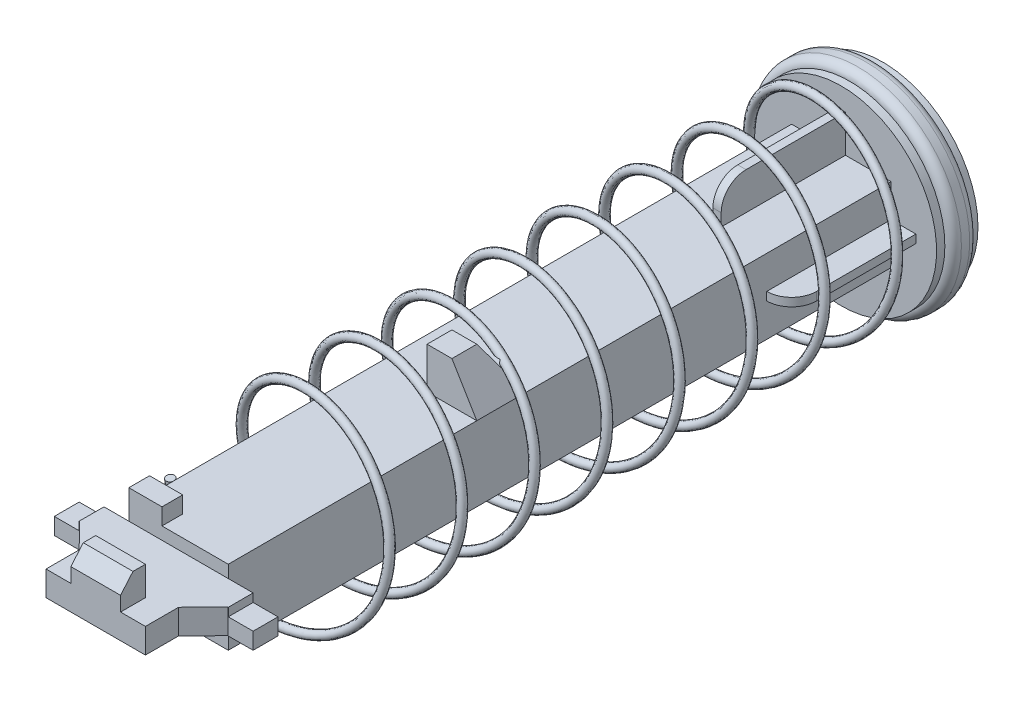
from build123d import *

# Parameters (mm, degrees)
SKETCH2_R            = 11.5
BOSS_EXTRUDE1_DEPTH  = 1
SKETCH3_R            = 12.5
BOSS_EXTRUDE2_DEPTH  = 3
FILLET1_R            = 1
SKETCH4_R            = 11.5
BOSS_EXTRUDE3_DEPTH  = 1
SKETCH5_W            = 12
SKETCH5_H            = 9
BOSS_EXTRUDE4_DEPTH  = 80
SKETCH6_W            = 1
SKETCH6_H            = 4.5
SKETCH6_W_2          = 3
SKETCH6_H_2          = 1
BOSS_EXTRUDE5_DEPTH  = 15
FILLET2_R            = 3
SWEEP1_PITCH         = 8.75
SKETCH28_R           = 7.5
CUT_EXTRUDE3_DEPTH   = 3
FILLET3_R            = 0.5
BOSS_EXTRUDE6_DEPTH  = 6
SKETCH34_W           = 12
SKETCH34_H           = 2
SKETCH34_H_2         = 1
BOSS_EXTRUDE7_DEPTH  = 4
SKETCH35_W           = 6
SKETCH35_H           = 3
BOSS_EXTRUDE8_DEPTH  = 2
SKETCH44_W           = 6
SKETCH44_H           = 3
BOSS_EXTRUDE12_DEPTH = 3
SKETCH37_W           = 4
SKETCH37_H           = 2.5
BOSS_EXTRUDE9_DEPTH  = 2
CUT_EXTRUDE5_DEPTH   = 97.630740463
SKETCH39_W           = 6
SKETCH39_H           = 6
BOSS_EXTRUDE10_DEPTH = 5
CUT_EXTRUDE6_REACH   = 59.771
CUT_EXTRUDE7_REACH   = 98.631
CUT_EXTRUDE8_REACH   = 99.064


with BuildPart() as part:
    # Sketch2 → Boss-Extrude1 (new body)
    with BuildSketch(Plane.XY):
        Circle(SKETCH2_R)
    extrude(amount=BOSS_EXTRUDE1_DEPTH)

    # Sketch3 → Boss-Extrude2 (add)
    with BuildSketch(Plane.XY.offset(1)):
        Circle(SKETCH3_R)
    extrude(amount=BOSS_EXTRUDE2_DEPTH)

    # Fillet1
    fillet1_edges = [part.edges().sort_by_distance(p)[0] for p in [
        (-12.5, 0, 1),
        (-12.5, 0, 4),
    ]]
    fillet(fillet1_edges, radius=FILLET1_R - 0.0001)  # a hair under: the kernel refuses the full size

    # Sketch4 → Boss-Extrude3 (add)
    with BuildSketch(Plane.XY.offset(4)):
        Circle(SKETCH4_R)
    extrude(amount=BOSS_EXTRUDE3_DEPTH)

    # Sketch5 → Boss-Extrude4 (add)
    with BuildSketch(Plane.XY.offset(5)):
        Rectangle(SKETCH5_W, SKETCH5_H)
    extrude(amount=BOSS_EXTRUDE4_DEPTH)

    # Sketch6 → Boss-Extrude5 (add)
    with BuildSketch(Plane.XY.offset(5)):
        with Locations((0, 6.75)):
            Rectangle(SKETCH6_W, SKETCH6_H)
        with Locations((7.5, 0.017199554)):
            Rectangle(SKETCH6_W_2, SKETCH6_H_2)
        with Locations((0, -6.75)):
            Rectangle(SKETCH6_W, SKETCH6_H)
        with Locations((-7.5, 0.017199554)):
            Rectangle(SKETCH6_W_2, SKETCH6_H_2)
    extrude(amount=BOSS_EXTRUDE5_DEPTH)

    # Fillet2
    fillet2_edges = [part.edges().sort_by_distance(p)[0] for p in [
        (9, 0.017199554, 20),
        (0, -9, 20),
        (0, 9, 20),
        (-9, 0.017199554, 20),
    ]]
    fillet(fillet2_edges, radius=FILLET2_R - 0.0001)  # a hair under: the kernel refuses the full size

    # Sweep1: arcs per turn and ends read off the stored shape
    # Sweep1: the profile of Sweep1 profile screwed along a left-hand helix through 8 turns, 16 arcs to a turn; built about Z, then put on its axis
    sweep1_z = Axis((0, 0, 0), (0, 0, 1))
    sweep1_corners = [(11, 0.062799, 0.496040609), (10.5, 0, 0), (11, -0.062799, -0.496040609), (11.5, 0, 0)]
    with BuildLine(mode=Mode.PRIVATE) as sweep1_profile:
        ThreePointArc((11, 0.062799, 0.496040609), (10.646446609, 0.044405599, 0.350753678), (10.5, 0, 0))
        ThreePointArc((10.5, 0, 0), (10.646446609, -0.044405599, -0.350753678), (11, -0.062799, -0.496040609))
        ThreePointArc((11, -0.062799, -0.496040609), (11.353553391, -0.044405599, -0.350753678), (11.5, 0, 0))
        ThreePointArc((11.5, 0, 0), (11.353553391, 0.044405599, 0.350753678), (11, 0.062799, 0.496040609))
    sweep1_cap = Face(sweep1_profile.wire())
    sweep1_arcs = [((11, 0.062799, 0.496040609), (10.5, 0.062799, 0.496040609), (10.5, 0, 0), (1, 0.7071067811865476, 1)), ((10.5, 0, 0), (10.5, -0.062799, -0.496040609), (11, -0.062799, -0.496040609), (1, 0.7071067811865476, 1)), ((11, -0.062799, -0.496040609), (11.5, -0.062799, -0.496040609), (11.5, 0, 0), (1, 0.7071067811865476, 1)), ((11.5, 0, 0), (11.5, 0.062799, 0.496040609), (11, 0.062799, 0.496040609), (1, 0.7071067811865476, 1))]  # start, shoulder, end, weights
    sweep1_turn_angles = [0, -11.25, -22.5, -33.75, -45, -56.25, -67.5, -78.75, -90, -101.25, -112.5, -123.75, -135, -146.25, -157.5, -168.75, -180, -191.25, -202.5, -213.75, -225, -236.25, -247.5, -258.75, -270, -281.25, -292.5, -303.75, -315, -326.25, -337.5, -348.75, -360]
    sweep1_turn_weights = [1, 0.9807852804032304, 1, 0.9807852804032304, 1, 0.9807852804032304, 1, 0.9807852804032304, 1, 0.9807852804032304, 1, 0.9807852804032304, 1, 0.9807852804032304, 1, 0.9807852804032304, 1, 0.9807852804032304, 1, 0.9807852804032304, 1, 0.9807852804032304, 1, 0.9807852804032304, 1, 0.9807852804032304, 1, 0.9807852804032304, 1, 0.9807852804032304, 1, 0.9807852804032304, 1]
    sweep1_turn_sides = [Face.make_bezier_surface([[Vector(p[j][0], p[j][1], 0).rotate(sweep1_z, sweep1_turn_angles[2 * i + k]) / sweep1_turn_weights[2 * i + k] + Vector(0, 0, p[j][2] + -SWEEP1_PITCH * sweep1_turn_angles[2 * i + k] / 360) for k in range(3)] for j in range(3)], [[p[3][j] * sweep1_turn_weights[2 * i + k] for k in range(3)] for j in range(3)]) for p in sweep1_arcs for i in range(16)]
    sweep1 = Plane(origin=(0, 0, 5), x_dir=(-1, 0, 0), z_dir=(0, 0, 1)) * Solid(Shell([*[p.moved(Location((0, 0, SWEEP1_PITCH * i))) for i in range(8) for p in sweep1_turn_sides], sweep1_cap, sweep1_cap.rotate(sweep1_z, -2880).moved(Location((0, 0, -SWEEP1_PITCH * -2880 / 360)))]))
    add(sweep1)

    # Sketch28 → Cut-Extrude3 (cut)
    with BuildSketch(Plane(origin=(0, 0, 0), x_dir=(-1, 0, 0), z_dir=(0, 0, -1))):
        Circle(SKETCH28_R)
    extrude(amount=-CUT_EXTRUDE3_DEPTH, mode=Mode.SUBTRACT)

    # Fillet3
    fillet3_edges = [part.edges().sort_by_distance(p)[0] for p in [
        (7.5, 0, 0),
    ]]
    fillet(fillet3_edges, radius=FILLET3_R)

    # Sketch33 → Boss-Extrude6 (add)
    with BuildSketch(Plane.XY.offset(85)):
        Polygon((9, 3), (-9, 3), (-9, 2), (-12, 2), (-12, 0), (12, 0), (12, 2), (9, 2), align=None)
    extrude(amount=BOSS_EXTRUDE6_DEPTH)

    # Sketch34 → Boss-Extrude7 (add)
    with BuildSketch(Plane.XY.offset(91)):
        with Locations((0, 1)):
            Rectangle(SKETCH34_W, SKETCH34_H)
        with Locations((0, 2.5)):
            Rectangle(SKETCH34_W, SKETCH34_H_2)
    extrude(amount=BOSS_EXTRUDE7_DEPTH)



with BuildPart() as body_2:
    # Sketch35 → Boss-Extrude8 (new body)
    with BuildSketch(Plane(origin=(0, 4.5, 0), x_dir=(1, 0, 0), z_dir=(0, 1, 0))):
        with Locations((0, -93.5)):
            Rectangle(SKETCH35_W, SKETCH35_H)
    extrude(amount=BOSS_EXTRUDE8_DEPTH)


with BuildPart() as part_1:
    add(part.part)

    add(body_2.part)  # Boss-Extrude12 merges body 2
    # Sketch44 → Boss-Extrude12 (add)
    with BuildSketch(Plane(origin=(0, 3, 0), x_dir=(1, 0, 0), z_dir=(0, 1, 0))):
        with Locations((0, -93.5)):
            Rectangle(SKETCH44_W, SKETCH44_H)
    extrude(amount=BOSS_EXTRUDE12_DEPTH)

    # Sketch37 → Boss-Extrude9 (add)
    with BuildSketch(Plane(origin=(0, 4.5, 0), x_dir=(1, 0, 0), z_dir=(0, 1, 0))):
        with Locations((-4, -83.75)):
            Rectangle(SKETCH37_W, SKETCH37_H)
    extrude(amount=BOSS_EXTRUDE9_DEPTH)

    # Sketch38 → Cut-Extrude5 (cut, through all)
    with BuildSketch(Plane.XZ):
        Polygon((-12, 91), (-12, 88), (-8.939136167, 88), (-6, 91), align=None)
        Polygon((12, 91), (6, 91), (8.939136167, 88), (12, 88), align=None)
    extrude(amount=-CUT_EXTRUDE5_DEPTH, mode=Mode.SUBTRACT)

    # Sketch39 → Boss-Extrude10 (add)
    with BuildSketch(Plane(origin=(0, 4.5, 0), x_dir=(1, 0, 0), z_dir=(0, 1, 0))):
        with Locations((3, -52)):
            Rectangle(SKETCH39_W, SKETCH39_H)
    extrude(amount=BOSS_EXTRUDE10_DEPTH)

    # Sketch42 → Cut-Extrude6 (cut, up to next)
    with BuildSketch(Plane.XY.offset(55), mode=Mode.PRIVATE) as cut_extrude6_sk1:
        Polygon((3, 9.5), (6, 4.5), (6, 9.5), align=None)
    cut_extrude6_tool1 = extrude(cut_extrude6_sk1.sketch, amount=-CUT_EXTRUDE6_REACH, mode=Mode.PRIVATE) & part_1.part
    add(cut_extrude6_tool1.solids().sort_by_distance((5, 7.833333, 55))[0], mode=Mode.SUBTRACT)

    # Cut-Extrude7: up to this plane
    cut_extrude7_end = Plane(origin=(6.397058824, 3.838235294, -0.001), z_dir=(0.8574929257125442, 0.5144957554275267, 0))
    # Sketch43 → Cut-Extrude7 (cut, up to the surface)
    with BuildSketch(Plane.ZY, mode=Mode.PRIVATE) as cut_extrude7_sk1:
        Polygon((49, 4.5), (52, 9.5), (49, 9.5), align=None)
    cut_extrude7_tool1 = split(extrude(cut_extrude7_sk1.sketch, amount=-CUT_EXTRUDE7_REACH, mode=Mode.PRIVATE), bisect_by=cut_extrude7_end, keep=Keep.BOTH, mode=Mode.PRIVATE)
    add(cut_extrude7_tool1.solids().sort_by_distance((0, 7.833333, 50))[0], mode=Mode.SUBTRACT)

    # Sketch45 → Cut-Extrude8 (cut, up to next)
    with BuildSketch(Plane(origin=(3, 0, 0), x_dir=(0, 0, -1), z_dir=(1, 0, 0)), mode=Mode.PRIVATE) as cut_extrude8_sk1:
        Polygon((-95, 4.75), (-93.5, 6.5), (-95, 6.5), align=None)
    cut_extrude8_tool1 = extrude(cut_extrude8_sk1.sketch, amount=-CUT_EXTRUDE8_REACH, mode=Mode.PRIVATE) & part_1.part
    add(cut_extrude8_tool1.solids().sort_by_distance((3, 5.916667, 94.5))[0], mode=Mode.SUBTRACT)


solid = part_1.part
